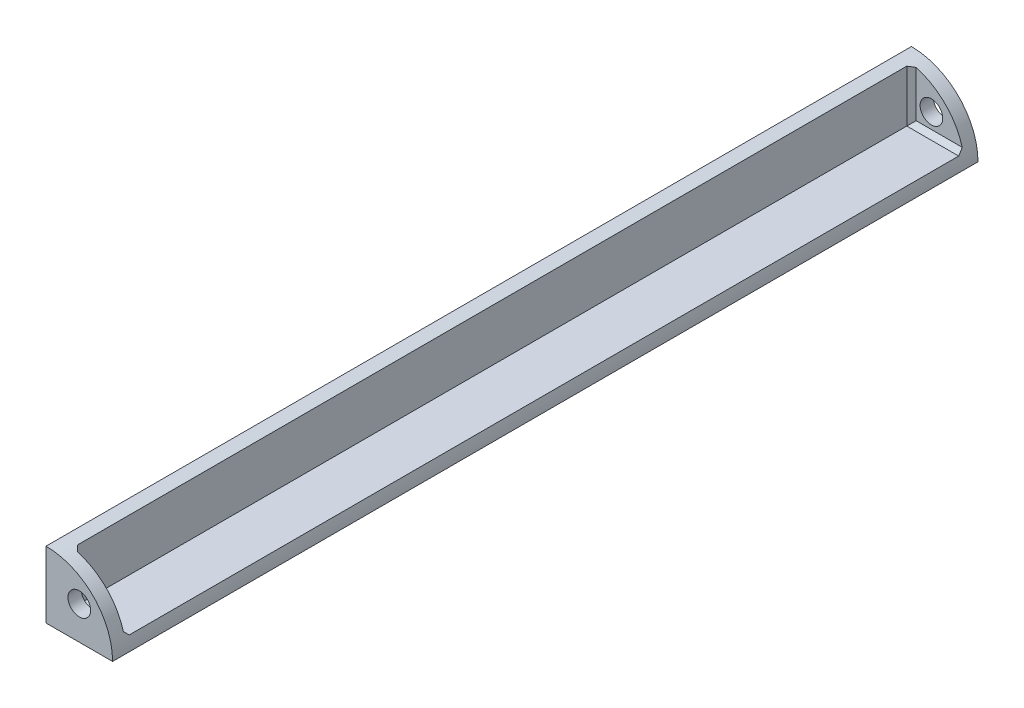
from build123d import *

# Parameters (mm, degrees)
SKETCH1_R           = 1.7
BOSS_EXTRUDE1_DEPTH = 2
SKETCH2_W           = 2
SKETCH2_H           = 2
BOSS_EXTRUDE2_DEPTH = 126
SKETCH3_R           = 1.7
BOSS_EXTRUDE3_DEPTH = 2
CHAMFER1_SIZE       = 0.7


with BuildPart() as part:
    # Sketch1 → Boss-Extrude1 (new body)
    with BuildSketch(Plane.XY):
        with BuildLine():
            Line((0, 0), (0, 10))
            ThreePointArc((0, 10), (7.071067812, 7.071067812), (10, 0))
            Line((10, 0), (0, 0))
        make_face()
        with Locations((5, 5)):
            Circle(SKETCH1_R, mode=Mode.SUBTRACT)
    extrude(amount=BOSS_EXTRUDE1_DEPTH)

    # Sketch2 → Boss-Extrude2 (add)
    with BuildSketch(Plane.XY.offset(2)):
        with Locations((1, 1)):
            Rectangle(SKETCH2_W, SKETCH2_H)
        with BuildLine():
            Line((0, 10), (0, 2))
            Line((0, 2), (2, 2))
            Line((2, 2), (2, 9.797958971))
            ThreePointArc((2, 9.797958971), (1.00508962, 9.94936153), (0, 10))
        make_face()
        with BuildLine():
            Line((2, 2), (2, 0))
            Line((2, 0), (10, 0))
            ThreePointArc((10, 0), (9.94936153, 1.00508962), (9.797958971, 2))
            Line((9.797958971, 2), (2, 2))
        make_face()
    extrude(amount=BOSS_EXTRUDE2_DEPTH)

    # Sketch3 → Boss-Extrude3 (add)
    # profile 1 of 2: a face of its own
    with BuildSketch(Plane.XY.offset(128)):
        with BuildLine():
            ThreePointArc((9.797958971, 2), (7.071067812, 7.071067812), (2, 9.797958971))
            Line((2, 9.797958971), (2, 2))
            Line((2, 2), (9.797958971, 2))
        make_face()
        with Locations((5, 5)):
            Circle(SKETCH3_R, mode=Mode.SUBTRACT)
    # profile 2 of 2: a face of its own
    with BuildSketch(Plane.XY.offset(128)):
        with BuildLine():
            ThreePointArc((10, 0), (9.94936153, 1.00508962), (9.797958971, 2))
            Line((9.797958971, 2), (2, 2))
            Line((2, 2), (2, 9.797958971))
            ThreePointArc((2, 9.797958971), (1.00508962, 9.94936153), (0, 10))
            Line((0, 10), (0, 0))
            Line((0, 0), (10, 0))
        make_face()
    extrude(amount=BOSS_EXTRUDE3_DEPTH)

    # Chamfer1
    # the kernel refuses this chamfer: 0.7 mm, written as the material it adds along each edge
    with BuildSketch(Plane(origin=(11.598137063, 2, 128), x_dir=(0, -0.027495876610586324, -0.9996219169112966), z_dir=(-1, 0, 0))) as chamfer1_piece_1_section:
        Polygon((CHAMFER1_SIZE * 0.999621916911, -CHAMFER1_SIZE * 0.0274958766106), (-CHAMFER1_SIZE * 0.0274958766106, -CHAMFER1_SIZE * 0.999621916911), (0, 0), align=None)
    chamfer1_piece_1 = extrude(amount=11.398315154, mode=Mode.PRIVATE)
    chamfer1_piece_1 = chamfer1_piece_1 & Plane(origin=(0, 0, 127.768642056), x_dir=(0, 1, 0), z_dir=(0, 0, -1)) * Cylinder(10, 26, mode=Mode.PRIVATE)
    add(chamfer1_piece_1)
    with BuildSketch(Plane(origin=(2, 11.598137063, 2), x_dir=(0.9996219169112968, 0, -0.027495876610586445), z_dir=(0, -1, 0))) as chamfer1_piece_2_section:
        Polygon((CHAMFER1_SIZE * 0.999621916911, CHAMFER1_SIZE * 0.0274958766106), (-CHAMFER1_SIZE * 0.0274958766106, CHAMFER1_SIZE * 0.999621916911), (0, 0), align=None)
    chamfer1_piece_2 = extrude(amount=11.398315154, mode=Mode.PRIVATE)
    chamfer1_piece_2 = chamfer1_piece_2 & Plane(origin=(0, 0, 2.231357944), x_dir=(0, 1, 0), z_dir=(0, 0, -1)) * Cylinder(10, 26, mode=Mode.PRIVATE)
    add(chamfer1_piece_2)
    with BuildSketch(Plane(origin=(2, 0.199821908, 128), x_dir=(0.9996219169112962, 0, 0.027495876610605856), z_dir=(0, 1, 0))) as chamfer1_piece_3_section:
        Polygon((CHAMFER1_SIZE * 0.999621916911, CHAMFER1_SIZE * 0.0274958766106), (-CHAMFER1_SIZE * 0.0274958766106, CHAMFER1_SIZE * 0.999621916911), (0, 0), align=None)
    chamfer1_piece_3 = extrude(amount=11.398315154, mode=Mode.PRIVATE)
    chamfer1_piece_3 = chamfer1_piece_3 & Plane(origin=(0, 0, 127.769144461), x_dir=(0, 1, 0), z_dir=(0, 0, -1)) * Cylinder(10, 26, mode=Mode.PRIVATE)
    add(chamfer1_piece_3)
    with BuildSketch(Plane(origin=(11.598137063, 2, 2), x_dir=(0, 0.9996219169112968, -0.027495876610586445), z_dir=(-1, 0, 0))) as chamfer1_piece_4_section:
        Polygon((CHAMFER1_SIZE * 0.999621916911, -CHAMFER1_SIZE * 0.0274958766106), (-CHAMFER1_SIZE * 0.0274958766106, -CHAMFER1_SIZE * 0.999621916911), (0, 0), align=None)
    chamfer1_piece_4 = extrude(amount=11.398315154, mode=Mode.PRIVATE)
    chamfer1_piece_4 = chamfer1_piece_4 & Plane(origin=(0, 0, 2.231357944), x_dir=(0, 1, 0), z_dir=(0, 0, -1)) * Cylinder(10, 26, mode=Mode.PRIVATE)
    add(chamfer1_piece_4)


solid = part.part
